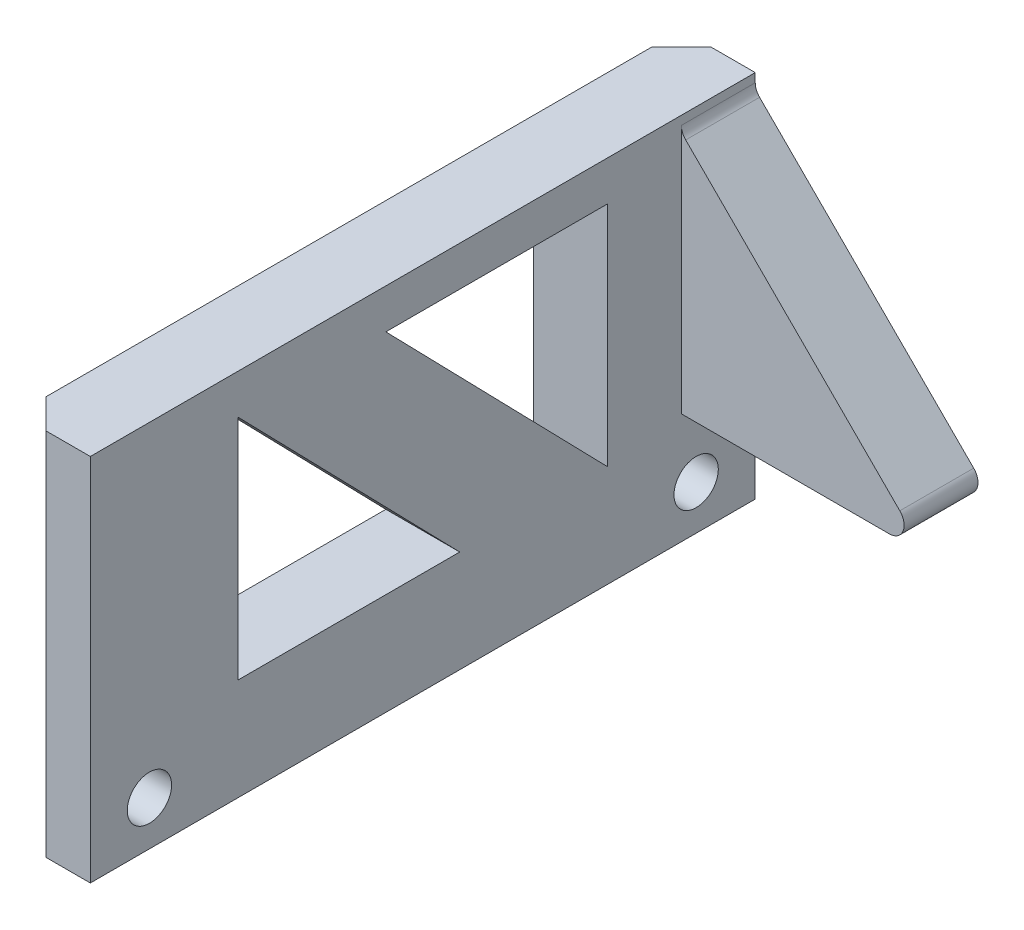
from build123d import *

# Parameters (mm, degrees)
SKETCH1_W           = 45
SKETCH1_H           = 25
BOSS_EXTRUDE1_DEPTH = 5
SKETCH2_R           = 1.5
CUT_EXTRUDE1_DEPTH  = 27.220221204
CUT_EXTRUDE2_DEPTH  = 27.220221204
CHAMFER2_SIZE       = 2
BOSS_EXTRUDE2_DEPTH = 5
FILLET1_R           = 1


with BuildPart() as part:
    # Sketch1 → Boss-Extrude1 (new body)
    with BuildSketch(Plane(origin=(0, 0, 0), x_dir=(0, 0, -1), z_dir=(1, 0, 0))):
        Rectangle(SKETCH1_W, SKETCH1_H)
    extrude(amount=BOSS_EXTRUDE1_DEPTH)

    # Sketch2 → Cut-Extrude1 (cut, through all)
    with BuildSketch(Plane(origin=(5, 0, 0), x_dir=(0, 0, -1), z_dir=(1, 0, 0))):
        with Locations((-18.5, -9.5)):
            Circle(SKETCH2_R)
        with Locations((18.5, -9.5)):
            Circle(SKETCH2_R)
    extrude(amount=-CUT_EXTRUDE1_DEPTH, mode=Mode.SUBTRACT)

    # Sketch3 → Cut-Extrude2 (cut, through all)
    with BuildSketch(Plane(origin=(5, 0, 0), x_dir=(0, 0, -1), z_dir=(1, 0, 0))):
        Polygon((-12.5, 9.80361421), (-12.5, -5.599476508), (2.5, -5.599476508), align=None)
        Polygon((-2.5, 9.80361421), (12.5, 9.80361421), (12.5, -5.599476508), align=None)
    extrude(amount=-CUT_EXTRUDE2_DEPTH, mode=Mode.SUBTRACT)

    # Chamfer2
    chamfer2_edges = [part.edges().sort_by_distance(p)[0] for p in [
        (0, 0, 22.5),
        (0, 0, -22.5),
    ]]
    chamfer(chamfer2_edges, length=CHAMFER2_SIZE)

    # Sketch4 → Boss-Extrude2 (add)
    with BuildSketch(Plane(origin=(0, 0, -22.5), x_dir=(-1, 0, 0), z_dir=(0, 0, -1))):
        Polygon((-5, -5), (-21.490292585, -5), (-5, 11.490292585), align=None)
    extrude(amount=-BOSS_EXTRUDE2_DEPTH)

    # Fillet1
    fillet1_edges = [part.edges().sort_by_distance(p)[0] for p in [
        (21.490292585, -5, -20),
        (5, 11.490292585, -20),
    ]]
    fillet(fillet1_edges, radius=FILLET1_R)


solid = part.part
